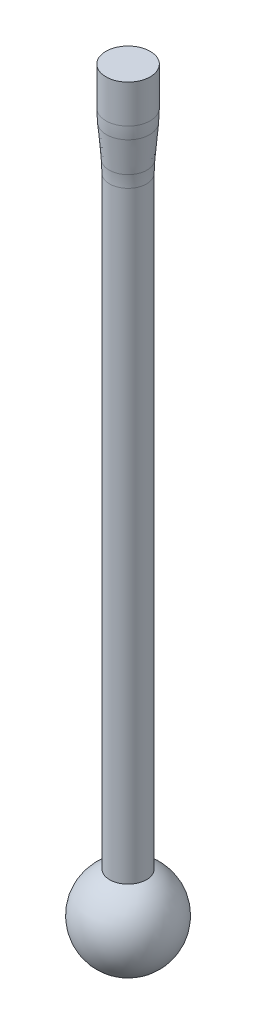
from build123d import *

# Parameters (mm, degrees)
FILLET1_R = 10


with BuildPart() as part:
    # Sketch2 → Revolve1 (revolve)
    with BuildSketch(Plane.XY):
        with BuildLine():
            Line((0, 0), (1.5, 0))
            Line((1.5, 0), (1.5, -3))
            Line((1.5, -3), (1.25, -6))
            Line((1.25, -6), (1.25, -47.272821971))
            ThreePointArc((1.25, -47.272821971), (2.931001031, -50.639713183), (0, -53))
            Line((0, -53), (0, 0))
        make_face()
    revolve(axis=Axis((0, -214.104441575, 0), (0, 1, 0)))

    # Fillet1
    # the kernel refuses this fillet: 10 mm, written as the material it adds along each edge
    with BuildSketch(Plane(origin=(0, -6, 0), x_dir=(1, 0, 0), z_dir=(0, 0, 1))) as fillet1_piece_1:
        with BuildLine():
            CenterArc((1.25 + FILLET1_R, -FILLET1_R * 0.0415945787923), FILLET1_R, 175.236358309, 4.763641691)
            Line((1.25, -FILLET1_R * 0.0415945787923), (1.25, 0))
            Line((1.25, 0), (1.25 + FILLET1_R * 0.00345424175512, FILLET1_R * 0.0414509010614))
        make_face()
    revolve(axis=Axis((0, -6, 0), (0, 1, 0)))
    # the kernel refuses this fillet: 10 mm, written as the material it takes off along each edge
    with BuildSketch(Plane(origin=(0, -3, 0), x_dir=(1, 0, 0), z_dir=(0, 0, 1))) as fillet1_2_piece_1:
        with BuildLine():
            CenterArc((1.5 - FILLET1_R, FILLET1_R * 0.0415945787923), FILLET1_R, 355.236358309, 4.763641691)
            Line((1.5 - FILLET1_R * 0.00345424175512, -FILLET1_R * 0.0414509010614), (1.5, 0))
            Line((1.5, 0), (1.5, FILLET1_R * 0.0415945787923))
        make_face()
    revolve(axis=Axis((0, -3, 0), (0, 1, 0)), mode=Mode.SUBTRACT)


solid = part.part
